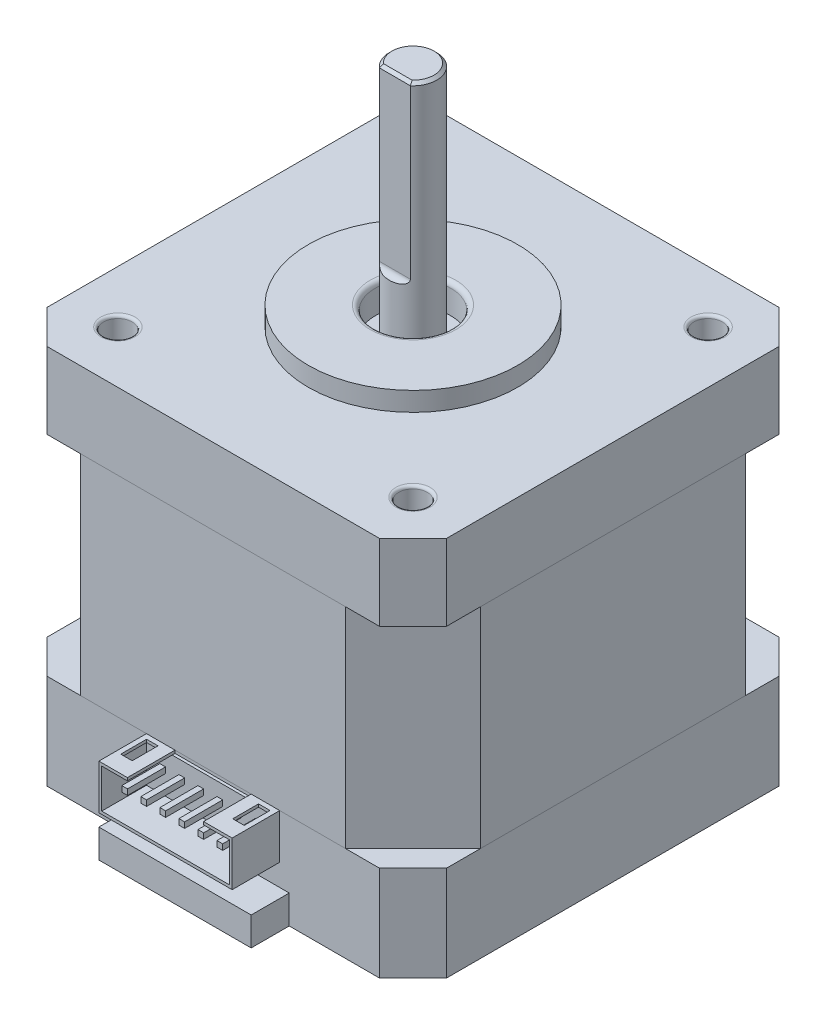
from build123d import *

# Parameters (mm, degrees)
BOTTOM_DEPTH           = 10
MIDDLE_DEPTH           = 22
TOP_DEPTH              = 10
SKETCH4_W              = 16
SKETCH4_H              = 3
JST_EXTENSION_DEPTH    = 4
SKETCH5_OUTSIDE_W      = 59.026
SKETCH5_OUTSIDE_H      = 63.026
SKETCH5_OUTSIDE_R      = 11
TOP_TRIM_DEPTH         = 2
SKETCH9_R              = 1.5
MOUNT_DEPTH            = 5
SKETCH6_R              = 4
SHAFT_RECESS_DEPTH     = 3
SKETCH7_R              = 2.5
SHAFT_DEPTH            = 25
D_SHAFT_TRIM_DEPTH     = 18.5
SHAFT_TOP_CHAMFER_SIZE = 0.3
SKETCH10_W             = 14
SKETCH10_H             = 4.7
JST_DEPTH              = 5
JST_SHELL_T            = -0.3
SKETCH11_W             = 8
SKETCH11_H             = 5.2916096
SKETCH11_W_2           = 1.205092783
SKETCH11_H_2           = 2.714921674
JST_SHAPER_DEPTH       = 0.3
SKETCH12_W             = 0.6
SKETCH12_H             = 0.6
JST_PINS_DEPTH         = 4
JST_PINS_2_DEPTH       = 4
JST_PINS_3_DEPTH       = 4
JST_PINS_4_DEPTH       = 4
JST_PINS_5_DEPTH       = 4
JST_PINS_6_DEPTH       = 4
FILLET2_R              = 0.5
FILLET3_R              = 0.3
FILLET4_R              = 0.6


with BuildPart() as part:
    # Sketch1 → bottom (new body)
    with BuildSketch(Plane(origin=(0, 0, 0), x_dir=(1, 0, 0), z_dir=(0, 1, 0))):
        Polygon((-21, 17.464466094), (-17.464466094, 21), (17.464466094, 21), (21, 17.464466094), (21, -17.464466094), (17.464466094, -21), (-17.464466094, -21), (-21, -17.464466094), align=None)
    extrude(amount=BOTTOM_DEPTH)

    # Sketch4 → JST_extension (add)
    with BuildSketch(Plane.XY.offset(21)):
        with Locations((0, 1.5)):
            Rectangle(SKETCH4_W, SKETCH4_H)
    extrude(amount=JST_EXTENSION_DEPTH)


with BuildPart() as body_2:
    # Sketch2 → middle (new body)
    with BuildSketch(Plane(origin=(0, 10, 0), x_dir=(1, 0, 0), z_dir=(0, 1, 0))):
        Polygon((-21, 13.928932188), (-13.928932188, 21), (13.928932188, 21), (21, 13.928932188), (21, -13.928932188), (13.928932188, -21), (-13.928932188, -21), (-21, -13.928932188), align=None)
    extrude(amount=MIDDLE_DEPTH)


with BuildPart() as body_3:
    # Sketch3 → top (new body)
    with BuildSketch(Plane(origin=(0, 32, 0), x_dir=(1, 0, 0), z_dir=(0, 1, 0))):
        Polygon((-21, 17.464466094), (-21, -17.464466094), (-17.464466094, -21), (17.464466094, -21), (21, -17.464466094), (21, 17.464466094), (17.464466094, 21), (-17.464466094, 21), align=None)
    extrude(amount=TOP_DEPTH)

    # Sketch5 outside → top trim (cut)
    with BuildSketch(Plane(origin=(0, 42, 0), x_dir=(1, 0, 0), z_dir=(0, 1, 0))):
        with Locations((0, -2)):
            Rectangle(SKETCH5_OUTSIDE_W, SKETCH5_OUTSIDE_H)
        with Locations(Location((0, 0, 0), (0, 0, 270))):
            Circle(SKETCH5_OUTSIDE_R, mode=Mode.SUBTRACT)
    extrude(amount=-TOP_TRIM_DEPTH, mode=Mode.SUBTRACT)

    # Sketch9 → mount (cut)
    with BuildSketch(Plane(origin=(0, 40, 0), x_dir=(1, 0, 0), z_dir=(0, 1, 0))):
        with Locations(Location((-15.5, 15.5, 0), (0, 0, 270))):
            Circle(SKETCH9_R)
        with Locations(Location((15.5, 15.5, 0), (0, 0, 90))):
            Circle(SKETCH9_R)
        with Locations(Location((-15.5, -15.5, 0), (0, 0, 90))):
            Circle(SKETCH9_R)
        with Locations(Location((15.5, -15.5, 0), (0, 0, 270))):
            Circle(SKETCH9_R)
    extrude(amount=-MOUNT_DEPTH, mode=Mode.SUBTRACT)

    # Sketch6 → shaft_recess (cut)
    with BuildSketch(Plane(origin=(0, 42, 0), x_dir=(1, 0, 0), z_dir=(0, 1, 0))):
        with Locations(Location((0, 0, 0), (0, 0, 270))):
            Circle(SKETCH6_R)
    extrude(amount=-SHAFT_RECESS_DEPTH, mode=Mode.SUBTRACT)

    # Fillet2
    fillet2_edges = [body_3.edges().sort_by_distance(p)[0] for p in [
        (0, 42, -4),
    ]]
    fillet(fillet2_edges, radius=FILLET2_R)

    # Fillet3
    fillet3_edges = [body_3.edges().sort_by_distance(p)[0] for p in [
        (15.5, 40, -14),
        (-15.5, 40, 17),
        (15.5, 40, 14),
        (-15.5, 40, -17),
    ]]
    fillet(fillet3_edges, radius=FILLET3_R)


with BuildPart() as body_4:
    # Sketch7 → shaft (new body)
    with BuildSketch(Plane(origin=(0, 39, 0), x_dir=(1, 0, 0), z_dir=(0, 1, 0))):
        with Locations(Location((0, 0, 0), (0, 0, 270))):
            Circle(SKETCH7_R)
    extrude(amount=SHAFT_DEPTH)

    # Sketch8 → D_shaft_trim (cut)
    with BuildSketch(Plane(origin=(0, 64, 0), x_dir=(1, 0, 0), z_dir=(0, 1, 0))):
        with BuildLine():
            Line((-1.624807681, -1.9), (1.624807681, -1.9))
            ThreePointArc((1.624807681, -1.9), (0, -2.5), (-1.624807681, -1.9))
        make_face()
    extrude(amount=-D_SHAFT_TRIM_DEPTH, mode=Mode.SUBTRACT)

    # shaft_top_chamfer
    shaft_top_chamfer_edges = [body_4.edges().sort_by_distance(p)[0] for p in [
        (0, 64, -2.5),
        (0, 64, 1.9),
    ]]
    chamfer(shaft_top_chamfer_edges, length=SHAFT_TOP_CHAMFER_SIZE)

    # Fillet4
    fillet4_edges = [body_4.edges().sort_by_distance(p)[0] for p in [
        (0, 45.5, 1.9),
    ]]
    fillet(fillet4_edges, radius=FILLET4_R - 0.0001)  # a hair under: the kernel refuses the full size


with BuildPart() as body_5:
    # Sketch10 → JST (new body)
    with BuildSketch(Plane.XY.offset(21)):
        with Locations((0, 7.65)):
            Rectangle(SKETCH10_W, SKETCH10_H)
    extrude(amount=JST_DEPTH)

    # JST_shell
    jst_shell_openings = [body_5.faces().sort_by_distance(p)[0] for p in [
        (0, 7.65, 26),
    ]]
    offset(amount=JST_SHELL_T, openings=jst_shell_openings, kind=Kind.INTERSECTION)

    # Sketch11 → JST_shaper (cut)
    with BuildSketch(Plane(origin=(0, 10, 0), x_dir=(1, 0, 0), z_dir=(0, 1, 0))):
        with Locations((0, -23.6458048)):
            Rectangle(SKETCH11_W, SKETCH11_H)
        with Locations((5.881647833, -22.86096009)):
            Rectangle(SKETCH11_W_2, SKETCH11_H_2)
        with Locations((-5.881647833, -22.86096009)):
            Rectangle(SKETCH11_W_2, SKETCH11_H_2)
    extrude(amount=-JST_SHAPER_DEPTH, mode=Mode.SUBTRACT)


with BuildPart() as body_6:
    # Sketch12 → JST_pins (new body)
    with BuildSketch(Plane.XY.offset(21.3)):
        with Locations((-2.99, 7.97753674)):
            Rectangle(SKETCH12_W, SKETCH12_H)
    extrude(amount=JST_PINS_DEPTH)


with BuildPart() as body_7:
    # Sketch12 → JST_pins 2 (new body)
    with BuildSketch(Plane.XY.offset(21.3)):
        with Locations((-4.99, 7.97753674)):
            Rectangle(SKETCH12_W, SKETCH12_H)
    extrude(amount=JST_PINS_2_DEPTH)


with BuildPart() as body_8:
    # Sketch12 → JST_pins 3 (new body)
    with BuildSketch(Plane.XY.offset(21.3)):
        with Locations((-0.99, 7.97753674)):
            Rectangle(SKETCH12_W, SKETCH12_H)
    extrude(amount=JST_PINS_3_DEPTH)


with BuildPart() as body_9:
    # Sketch12 → JST_pins 4 (new body)
    with BuildSketch(Plane.XY.offset(21.3)):
        with Locations((1.01, 7.97753674)):
            Rectangle(SKETCH12_W, SKETCH12_H)
    extrude(amount=JST_PINS_4_DEPTH)


with BuildPart() as body_10:
    # Sketch12 → JST_pins 5 (new body)
    with BuildSketch(Plane.XY.offset(21.3)):
        with Locations((3.01, 7.97753674)):
            Rectangle(SKETCH12_W, SKETCH12_H)
    extrude(amount=JST_PINS_5_DEPTH)


with BuildPart() as body_11:
    # Sketch12 → JST_pins 6 (new body)
    with BuildSketch(Plane.XY.offset(21.3)):
        with Locations((5.01, 7.97753674)):
            Rectangle(SKETCH12_W, SKETCH12_H)
    extrude(amount=JST_PINS_6_DEPTH)


solid = Compound([part.part, body_2.part, body_3.part, body_4.part, body_5.part, body_6.part, body_7.part, body_8.part, body_9.part, body_10.part, body_11.part])
